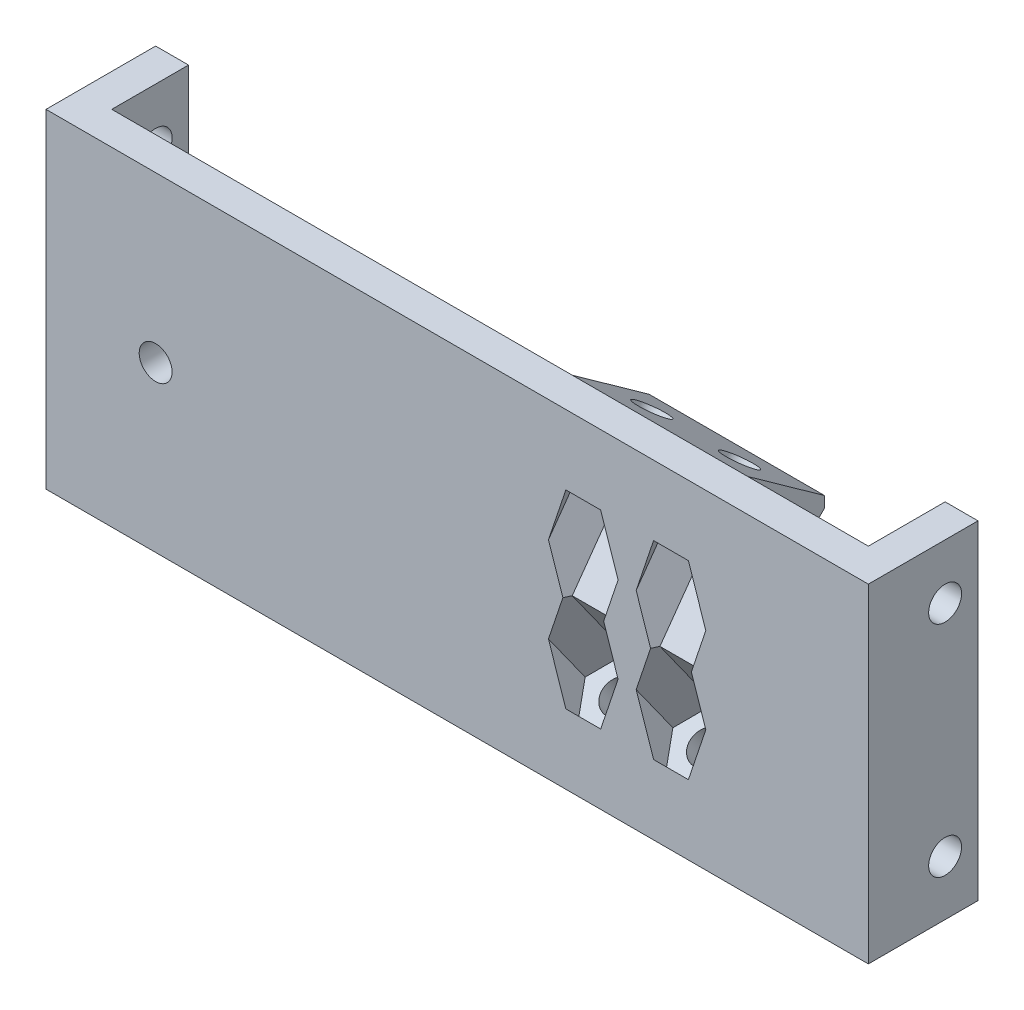
from build123d import *

# Parameters (mm, degrees)
SKETCH1_W               = 75
SKETCH1_H               = 30
BOSS_EXTRUDE1_DEPTH     = 3
SKETCH2_W               = 3
SKETCH2_H               = 30
BOSS_EXTRUDE2_DEPTH     = 7
SKETCH4_R               = 1.5
CUT_EXTRUDE1_DEPTH      = 3
MIRROR1_COPY_1_SKETCH_R = 1.5
MIRROR1_COPY_1_DEPTH    = 3
SKETCH5_W               = 16
SKETCH5_H               = 7
BOSS_EXTRUDE3_DEPTH     = 8
CHAMFER1_SIZE           = 5
CHAMFER1_SIZE2          = 7
CHAMFER2_SIZE           = 5
CHAMFER3_SIZE           = 2
SKETCH6_R               = 1.5
CUT_EXTRUDE2_DEPTH      = 8
CUT_EXTRUDE3_START      = -5
CUT_EXTRUDE3_DEPTH      = 42.149507332
CHAMFER4_SIZE           = 7
CHAMFER4_SIZE2          = 5
CHAMFER5_SIZE           = 5
CHAMFER6_SIZE           = 2
SKETCH8_R               = 1.5
CUT_EXTRUDE4_DEPTH      = 42.608292443


with BuildPart() as part:
    # Sketch1 → Boss-Extrude1 (new body)
    with BuildSketch(Plane.XY):
        Rectangle(SKETCH1_W, SKETCH1_H)
    extrude(amount=BOSS_EXTRUDE1_DEPTH)

    # Sketch2 → Boss-Extrude2 (add)
    with BuildSketch(Plane(origin=(0, 0, 0), x_dir=(-1, 0, 0), z_dir=(0, 0, -1))):
        with Locations((-36, 0)):
            Rectangle(SKETCH2_W, SKETCH2_H)
    boss_extrude2 = extrude(amount=BOSS_EXTRUDE2_DEPTH)

    # Sketch4 → Cut-Extrude1 (cut)
    with BuildSketch(Plane.ZY.offset(-34.5)):
        with Locations((-4, 10)):
            Circle(SKETCH4_R)
    cut_extrude1 = extrude(amount=-CUT_EXTRUDE1_DEPTH, mode=Mode.SUBTRACT)

    # Mirror2: Cut-Extrude1 across plane
    add(cut_extrude1.mirror(Plane.ZX), mode=Mode.SUBTRACT)

    # Mirror1: Boss-Extrude2, Cut-Extrude1 across plane
    add(boss_extrude2.mirror(Plane(origin=(0, 0, 0), x_dir=(0, 0, 1), z_dir=(1, 0, 0))))
    add(cut_extrude1.mirror(Plane(origin=(0, 0, 0), x_dir=(0, 0, 1), z_dir=(1, 0, 0))), mode=Mode.SUBTRACT)

    # Mirror1 copy 1 sketch → Mirror1 copy 1 (cut)
    with BuildSketch(Plane(origin=(-34.5, 0, 0), x_dir=(0, 0, 1), z_dir=(1, 0, 0))):
        with Locations((-4, 10)):
            Circle(MIRROR1_COPY_1_SKETCH_R)
    extrude(amount=-MIRROR1_COPY_1_DEPTH, mode=Mode.SUBTRACT)

    # Sketch5 → Boss-Extrude3 (add)
    with BuildSketch(Plane.XZ.offset(15)):
        with Locations((15.5, -3.5)):
            Rectangle(SKETCH5_W, SKETCH5_H)
    boss_extrude3 = extrude(amount=-BOSS_EXTRUDE3_DEPTH)

    # Chamfer1
    chamfer1_edges = [part.edges().sort_by_distance(p)[0] for p in [
        (15.5, -15, -7),
    ]]
    chamfer1_side = [part.faces().sort_by_distance(p)[0] for p in [
        (15.5, -11, -7),
    ]]
    chamfer(chamfer1_edges, length=CHAMFER1_SIZE, length2=CHAMFER1_SIZE2, reference=chamfer1_side[0])

    # Chamfer2
    chamfer2_edges = [part.edges().sort_by_distance(p)[0] for p in [
        (15.5, -7, 0),
    ]]
    chamfer(chamfer2_edges, length=CHAMFER2_SIZE)

    # Chamfer3
    chamfer3_edges = [part.edges().sort_by_distance(p)[0] for p in [
        (15.5, -7, -7),
    ]]
    chamfer(chamfer3_edges, length=CHAMFER3_SIZE - 0.0001)  # a hair under: the kernel refuses the full size

    # Sketch6 → Cut-Extrude2 (cut)
    with BuildSketch(Plane(origin=(0, -9.932432432, -7.094594595), x_dir=(1, 0, 0), z_dir=(0, -0.8137334712067358, -0.5812381937190955))):
        with Locations(Location((11.5, 4.718572906, 0), (0, 0, 270))):
            Circle(SKETCH6_R)
        with Locations(Location((19.5, 4.718572906, 0), (0, 0, 270))):
            Circle(SKETCH6_R)
    cut_extrude2 = extrude(amount=-CUT_EXTRUDE2_DEPTH, mode=Mode.SUBTRACT)

    # Sketch7 → Cut-Extrude3 (cut, through all)
    with BuildSketch(Plane(origin=(0, -9.932432432, -7.094594595), x_dir=(1, 0, 0), z_dir=(0, -0.8137334712067358, -0.5812381937190955)).offset(CUT_EXTRUDE3_START)):
        Polygon((8.324573519, 4.718572906), (9.91228676, 1.968572906), (13.08771324, 1.968572906), (14.675426481, 4.718572906), (13.08771324, 7.468572906), (9.91228676, 7.468572906), align=None)
        Polygon((16.324573519, 4.718572906), (17.91228676, 1.968572906), (21.08771324, 1.968572906), (22.675426481, 4.718572906), (21.08771324, 7.468572906), (17.91228676, 7.468572906), align=None)
    cut_extrude3 = extrude(amount=-CUT_EXTRUDE3_DEPTH, mode=Mode.SUBTRACT)

    # Mirror3: Boss-Extrude3 across plane
    add(boss_extrude3.mirror(Plane.ZX))

    # Chamfer4
    chamfer4_edges = [part.edges().sort_by_distance(p)[0] for p in [
        (15.5, 15, -7),
    ]]
    chamfer4_side = [part.faces().sort_by_distance(p)[0] for p in [
        (0, 15, 2.243362702),
    ]]
    chamfer(chamfer4_edges, length=CHAMFER4_SIZE, length2=CHAMFER4_SIZE2, reference=chamfer4_side[0])

    # Chamfer5
    chamfer5_edges = [part.edges().sort_by_distance(p)[0] for p in [
        (15.5, 7, 0),
    ]]
    chamfer(chamfer5_edges, length=CHAMFER5_SIZE)

    # Chamfer6
    chamfer6_edges = [part.edges().sort_by_distance(p)[0] for p in [
        (15.5, 7, -7),
    ]]
    chamfer(chamfer6_edges, length=CHAMFER6_SIZE - 0.0001)  # a hair under: the kernel refuses the full size

    # Mirror4: Cut-Extrude2, Cut-Extrude3 across plane
    add(cut_extrude2.mirror(Plane.ZX), mode=Mode.SUBTRACT)
    add(cut_extrude3.mirror(Plane.ZX), mode=Mode.SUBTRACT)

    # Sketch8 → Cut-Extrude4 (cut, through all)
    with BuildSketch(Plane.XY.offset(3)):
        with Locations((-27.5, 0)):
            Circle(SKETCH8_R)
    extrude(amount=-CUT_EXTRUDE4_DEPTH, mode=Mode.SUBTRACT)


solid = part.part
